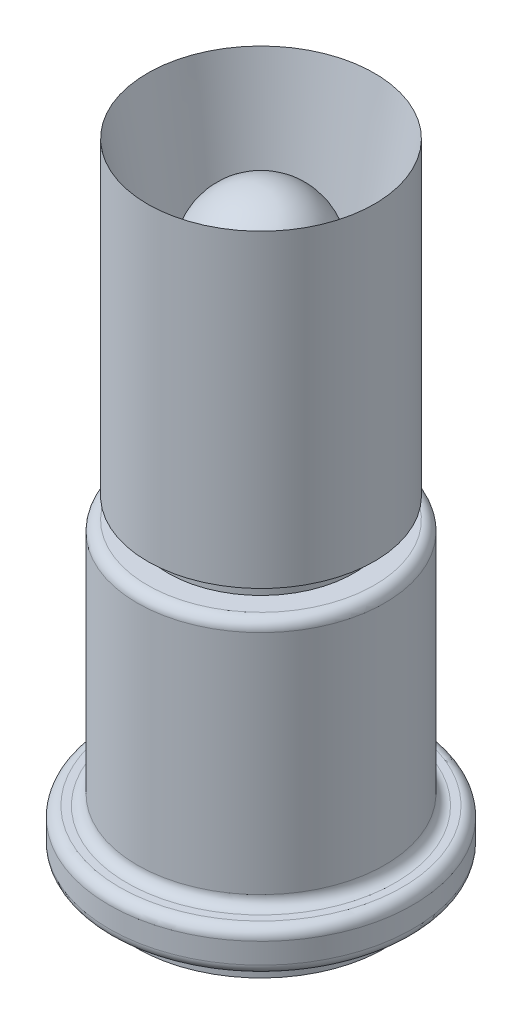
from build123d import *

# Parameters (mm, degrees)
SKETCH2_W = 3
SKETCH2_H = 0.5
FILLET1_R = 0.25


with BuildPart() as part:
    # Sketch1 → Revolve1 (revolve)
    with BuildSketch(Plane(origin=(0, 0, 0), x_dir=(0, 0, -1), z_dir=(1, 0, 0))):
        Polygon((0, 0), (3.68, 0), (3.68, 1), (3, 1), (3, 7), (2.25, 7), (2.25, 7.5), (2.75, 7.5), (2.75, 15), (0, 15), align=None)
    revolve(axis=Axis((0, 15, 0), (0, -1, 0)))

    # Sketch2 → Revolve2 (revolve)
    with BuildSketch(Plane(origin=(0, 0, 0), x_dir=(0, 0, -1), z_dir=(1, 0, 0))):
        with Locations((1.5, -0.25)):
            Rectangle(SKETCH2_W, SKETCH2_H)
    revolve(axis=Axis((0, 0, 0), (0, -1, 0)))

    # Sketch3 → Revolve3 (revolve)
    with BuildSketch(Plane(origin=(0, 0, 0), x_dir=(0, 0, -1), z_dir=(1, 0, 0))):
        with BuildLine():
            Line((0, -1), (0, 1))
            ThreePointArc((0, 1), (1, 0), (0, -1))
        make_face()
    revolve(axis=Axis((0, -1, 0), (0, 1, 0)))

    # Fillet1
    fillet1_edges = [part.edges().sort_by_distance(p)[0] for p in [
        (0, 0, 3.68),
        (0, 1, 3.68),
        (0, 7, 3),
        (0, 1, 3),
    ]]
    fillet(fillet1_edges, radius=FILLET1_R)

    # Sketch5 → Cut-Revolve1 (revolve, cut)
    with BuildSketch(Plane(origin=(0, 0, 0), x_dir=(0, 0, -1), z_dir=(1, 0, 0))):
        Polygon((0, 15), (0, 8), (1.5, 8), (2.75, 15), align=None)
    revolve(axis=Axis((0, 15, 0), (0, -1, 0)), mode=Mode.SUBTRACT)

    # Sketch6 → Revolve4 (revolve)
    with BuildSketch(Plane(origin=(0, 0, 0), x_dir=(0, 0, -1), z_dir=(1, 0, 0))):
        with BuildLine():
            Line((0, 8), (0, 12.5))
            Line((0, 12.5), (0, 14))
            ThreePointArc((0, 14), (1.060660172, 13.560660172), (1.5, 12.5))
            Line((1.5, 12.5), (1.5, 8))
            Line((1.5, 8), (0, 8))
        make_face()
    revolve(axis=Axis((0, 8, 0), (0, 1, 0)))


solid = part.part
